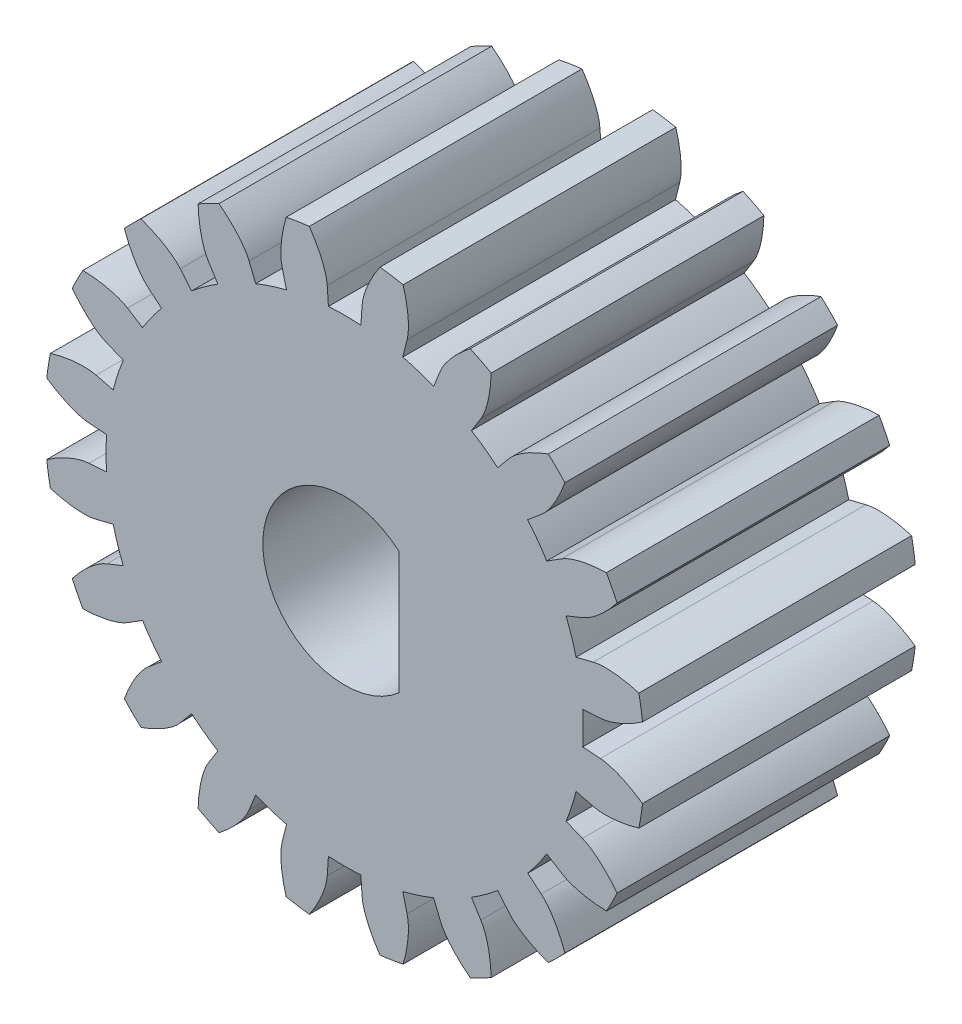
from build123d import *

# Parameters (mm, degrees)
SKETCH_1_R               = 5.5
SKETCH_1_R_2             = 1.475
EXTRUDE_1_DEPTH          = 5
CUT_EXTRUDE_1_DEPTH      = 10.246621004
PATTERN_CIRCULAR_1_DEPTH = 5
SKETCH_2_R               = 1.475
EXTRUDE_2_DEPTH          = 5
CUT_EXTRUDE_2_DEPTH      = 10.201182413


# Read off the part's stored shape, not the designer's step: 阵列(圆周)1
with BuildPart() as part:
    # 草图1 → 凸台-拉伸1 (new body)
    with BuildSketch(Plane.XY):
        Circle(SKETCH_1_R)
        Circle(SKETCH_1_R_2, mode=Mode.SUBTRACT)
    extrude(amount=EXTRUDE_1_DEPTH)

    # 草图1<3> → 切除-拉伸1 (cut, through all)
    with BuildSketch(Plane.XY):
        with BuildLine():
            Line((4.68759624, 0.319369739), (4.364881259, 0.297382905))
            ThreePointArc((4.364881259, 0.297382905), (4.372469583, 0.148777503), (4.375, 0))
            ThreePointArc((4.375, 0), (4.372469583, -0.148777503), (4.364881259, -0.297382905))
            Line((4.364881259, -0.297382905), (4.68759624, -0.319369739))
            add(Edge.make_bspline(
                [(4.68759624, -0.319369739), (4.723328518, -0.321804208), (4.822539562, -0.336024472), (5.006239619, -0.392562489), (5.199142564, -0.482491423), (5.35109765, -0.572850293), (5.444197274, -0.635344688), (5.461765036, -0.647396861)],
                knots=[0, 0, 0, 0, 0, 0.005604068, 0.015718248, 0.029959916, 0.033300536, 0.033300536, 0.033300536, 0.033300536, 0.033300536], degree=4))
            ThreePointArc((5.461765036, -0.647396861), (5.490432938, -0.324262474), (5.5, 0))
            ThreePointArc((5.5, 0), (5.490432938, 0.324262474), (5.461765036, 0.647396861))
            add(Edge.make_bspline(
                [(4.68759624, 0.319369739), (4.723328518, 0.321804208), (4.822539562, 0.336024472), (5.006239619, 0.392562489), (5.199142564, 0.482491423), (5.35109765, 0.572850293), (5.444197274, 0.635344688), (5.461765036, 0.647396861)],
                knots=[0, 0, 0, 0, 0, 0.005604068, 0.015718248, 0.029959916, 0.033300536, 0.033300536, 0.033300536, 0.033300536, 0.033300536], degree=4))
        make_face()
    extrude(amount=CUT_EXTRUDE_1_DEPTH, mode=Mode.SUBTRACT)

    # 阵列(圆周)1 outline → 阵列(圆周)1 (cut)
    with BuildSketch(Plane.XY):
        with BuildLine():
            Line((4.243145136, 1.065994538), (4.556859627, 1.14480823))
            add(Edge.make_bspline(
                [(4.556859627, 1.14480823), (4.591595335, 1.153534793), (4.690344948, 1.170668417), (4.882525293, 1.173664007), (5.093776464, 1.147746796), (5.266216765, 1.108767108), (5.374071599, 1.078100773), (5.39450386, 1.072067212)],
                knots=[0, 0, 0, 0, 0, 0.005604068, 0.015718248, 0.029959916, 0.033300536, 0.033300536, 0.033300536, 0.033300536, 0.033300536], degree=4))
            ThreePointArc((5.39450386, 1.072067212), (5.23081084, 1.699593469), (4.994390596, 2.303489219))
            add(Edge.make_bspline(
                [(4.359478273, 1.752285572), (4.392709397, 1.765642771), (4.482670403, 1.809824945), (4.639908332, 1.920362233), (4.795580365, 2.065500021), (4.912175813, 2.198393117), (4.981406987, 2.286598184), (4.994390596, 2.303489219)],
                knots=[0, 0, 0, 0, 0, 0.005604068, 0.015718248, 0.029959916, 0.033300536, 0.033300536, 0.033300536, 0.033300536, 0.033300536], degree=4))
            Line((4.359478273, 1.752285572), (4.059352393, 1.631650437))
            ThreePointArc((4.059352393, 1.631650437), (4.160872259, 1.35194935), (4.243145136, 1.065994538))
        make_face()
        with BuildLine():
            add(Edge.make_bspline(
                [(4.359478273, -1.752285572), (4.392709397, -1.765642771), (4.482670403, -1.809824945), (4.639908332, -1.920362233), (4.795580365, -2.065500021), (4.912175813, -2.198393117), (4.981406987, -2.286598184), (4.994390595, -2.303489218)],
                knots=[0, 0, 0, 0, 0, 0.005604068, 0.015718248, 0.029959916, 0.033300536, 0.033300536, 0.033300536, 0.033300536, 0.033300536], degree=4))
            ThreePointArc((4.994390595, -2.303489218), (5.23081084, -1.699593469), (5.39450386, -1.072067212))
            add(Edge.make_bspline(
                [(4.556859627, -1.14480823), (4.591595335, -1.153534793), (4.690344948, -1.170668417), (4.882525293, -1.173664007), (5.093776464, -1.147746796), (5.266216765, -1.108767108), (5.374071599, -1.078100773), (5.39450386, -1.072067212)],
                knots=[0, 0, 0, 0, 0, 0.005604068, 0.015718248, 0.029959916, 0.033300536, 0.033300536, 0.033300536, 0.033300536, 0.033300536], degree=4))
            Line((4.556859627, -1.14480823), (4.243145136, -1.065994538))
            ThreePointArc((4.243145136, -1.065994538), (4.160872259, -1.35194935), (4.059352393, -1.631650437))
            Line((4.059352393, -1.631650437), (4.359478273, -1.752285572))
        make_face()
        with BuildLine():
            add(Edge.make_bspline(
                [(3.604624198, -3.013675485), (3.632101274, -3.036647918), (3.704006232, -3.106467142), (3.819390489, -3.260183543), (3.922593347, -3.446323085), (3.992415983, -3.608741904), (4.031001877, -3.714023518), (4.038130406, -3.734100002)],
                knots=[0, 0, 0, 0, 0, 0.005604068, 0.015718248, 0.029959916, 0.033300536, 0.033300536, 0.033300536, 0.033300536, 0.033300536], degree=4))
            ThreePointArc((4.038130406, -3.734100002), (4.449593469, -3.232818888), (4.799191061, -2.686589877))
            add(Edge.make_bspline(
                [(3.980065843, -2.496924392), (4.010404809, -2.515957772), (4.099026691, -2.562768124), (4.280875372, -2.625004093), (4.489796033, -2.665635562), (4.665841891, -2.681850659), (4.777894353, -2.686014218), (4.799191061, -2.686589877)],
                knots=[0, 0, 0, 0, 0, 0.005604068, 0.015718248, 0.029959916, 0.033300536, 0.033300536, 0.033300536, 0.033300536, 0.033300536], degree=4))
            Line((3.980065843, -2.496924392), (3.706060403, -2.325025008))
            ThreePointArc((3.706060403, -2.325025008), (3.53944935, -2.571560479), (3.356465831, -2.806200656))
            Line((3.356465831, -2.806200656), (3.604624198, -3.013675485))
        make_face()
        with BuildLine():
            add(Edge.make_bspline(
                [(2.496924392, -3.980065843), (2.515957772, -4.010404809), (2.562768124, -4.099026691), (2.625004093, -4.280875372), (2.665635562, -4.489796033), (2.681850659, -4.665841891), (2.686014218, -4.777894353), (2.686589877, -4.79919106)],
                knots=[0, 0, 0, 0, 0, 0.005604068, 0.015718248, 0.029959916, 0.033300536, 0.033300536, 0.033300536, 0.033300536, 0.033300536], degree=4))
            ThreePointArc((2.686589877, -4.79919106), (3.232818888, -4.449593469), (3.734100002, -4.038130406))
            add(Edge.make_bspline(
                [(3.013675485, -3.604624198), (3.036647918, -3.632101274), (3.106467142, -3.704006232), (3.260183543, -3.819390489), (3.446323085, -3.922593347), (3.608741904, -3.992415983), (3.714023518, -4.031001877), (3.734100002, -4.038130406)],
                knots=[0, 0, 0, 0, 0, 0.005604068, 0.015718248, 0.029959916, 0.033300536, 0.033300536, 0.033300536, 0.033300536, 0.033300536], degree=4))
            Line((3.013675485, -3.604624198), (2.806200656, -3.356465831))
            ThreePointArc((2.806200656, -3.356465831), (2.571560479, -3.53944935), (2.325025008, -3.706060403))
            Line((2.325025008, -3.706060403), (2.496924392, -3.980065843))
        make_face()
        with BuildLine():
            add(Edge.make_bspline(
                [(1.14480823, -4.556859627), (1.153534793, -4.591595335), (1.170668417, -4.690344948), (1.173664007, -4.882525293), (1.147746796, -5.093776464), (1.108767108, -5.266216765), (1.078100773, -5.374071599), (1.072067212, -5.39450386)],
                knots=[0, 0, 0, 0, 0, 0.005604068, 0.015718248, 0.029959916, 0.033300536, 0.033300536, 0.033300536, 0.033300536, 0.033300536], degree=4))
            ThreePointArc((1.072067212, -5.39450386), (1.699593469, -5.23081084), (2.303489219, -4.994390596))
            add(Edge.make_bspline(
                [(1.752285572, -4.359478273), (1.765642771, -4.392709397), (1.809824945, -4.482670403), (1.920362233, -4.639908332), (2.065500021, -4.795580365), (2.198393117, -4.912175813), (2.286598184, -4.981406987), (2.303489219, -4.994390596)],
                knots=[0, 0, 0, 0, 0, 0.005604068, 0.015718248, 0.029959916, 0.033300536, 0.033300536, 0.033300536, 0.033300536, 0.033300536], degree=4))
            Line((1.752285572, -4.359478273), (1.631650437, -4.059352393))
            ThreePointArc((1.631650437, -4.059352393), (1.35194935, -4.160872259), (1.065994538, -4.243145136))
            Line((1.065994538, -4.243145136), (1.14480823, -4.556859627))
        make_face()
        with BuildLine():
            add(Edge.make_bspline(
                [(-0.319369739, -4.68759624), (-0.321804208, -4.723328518), (-0.336024472, -4.822539562), (-0.392562489, -5.006239619), (-0.482491423, -5.199142564), (-0.572850293, -5.35109765), (-0.635344688, -5.444197274), (-0.647396861, -5.461765036)],
                knots=[0, 0, 0, 0, 0, 0.005604068, 0.015718248, 0.029959916, 0.033300536, 0.033300536, 0.033300536, 0.033300536, 0.033300536], degree=4))
            ThreePointArc((-0.647396861, -5.461765036), (0, -5.5), (0.647396861, -5.461765036))
            add(Edge.make_bspline(
                [(0.319369739, -4.68759624), (0.321804208, -4.723328518), (0.336024472, -4.822539562), (0.392562489, -5.006239619), (0.482491423, -5.199142564), (0.572850293, -5.35109765), (0.635344688, -5.444197274), (0.647396861, -5.461765036)],
                knots=[0, 0, 0, 0, 0, 0.005604068, 0.015718248, 0.029959916, 0.033300536, 0.033300536, 0.033300536, 0.033300536, 0.033300536], degree=4))
            Line((0.319369739, -4.68759624), (0.297382905, -4.364881259))
            ThreePointArc((0.297382905, -4.364881259), (0, -4.375), (-0.297382905, -4.364881259))
            Line((-0.297382905, -4.364881259), (-0.319369739, -4.68759624))
        make_face()
        with BuildLine():
            add(Edge.make_bspline(
                [(-1.752285572, -4.359478273), (-1.765642771, -4.392709397), (-1.809824945, -4.482670403), (-1.920362233, -4.639908332), (-2.065500021, -4.795580365), (-2.198393117, -4.912175813), (-2.286598184, -4.981406987), (-2.303489218, -4.994390595)],
                knots=[0, 0, 0, 0, 0, 0.005604068, 0.015718248, 0.029959916, 0.033300536, 0.033300536, 0.033300536, 0.033300536, 0.033300536], degree=4))
            ThreePointArc((-2.303489218, -4.994390595), (-1.699593469, -5.23081084), (-1.072067212, -5.39450386))
            add(Edge.make_bspline(
                [(-1.14480823, -4.556859627), (-1.153534793, -4.591595335), (-1.170668417, -4.690344948), (-1.173664007, -4.882525293), (-1.147746796, -5.093776464), (-1.108767108, -5.266216765), (-1.078100773, -5.374071599), (-1.072067212, -5.39450386)],
                knots=[0, 0, 0, 0, 0, 0.005604068, 0.015718248, 0.029959916, 0.033300536, 0.033300536, 0.033300536, 0.033300536, 0.033300536], degree=4))
            Line((-1.14480823, -4.556859627), (-1.065994538, -4.243145136))
            ThreePointArc((-1.065994538, -4.243145136), (-1.35194935, -4.160872259), (-1.631650437, -4.059352393))
            Line((-1.631650437, -4.059352393), (-1.752285572, -4.359478273))
        make_face()
        with BuildLine():
            add(Edge.make_bspline(
                [(-3.013675485, -3.604624198), (-3.036647918, -3.632101274), (-3.106467142, -3.704006232), (-3.260183543, -3.819390489), (-3.446323085, -3.922593347), (-3.608741904, -3.992415983), (-3.714023518, -4.031001877), (-3.734100002, -4.038130406)],
                knots=[0, 0, 0, 0, 0, 0.005604068, 0.015718248, 0.029959916, 0.033300536, 0.033300536, 0.033300536, 0.033300536, 0.033300536], degree=4))
            ThreePointArc((-3.734100002, -4.038130406), (-3.232818888, -4.449593469), (-2.686589877, -4.79919106))
            add(Edge.make_bspline(
                [(-2.496924392, -3.980065843), (-2.515957772, -4.010404809), (-2.562768124, -4.099026691), (-2.625004093, -4.280875372), (-2.665635562, -4.489796033), (-2.681850659, -4.665841891), (-2.686014218, -4.777894353), (-2.686589877, -4.79919106)],
                knots=[0, 0, 0, 0, 0, 0.005604068, 0.015718248, 0.029959916, 0.033300536, 0.033300536, 0.033300536, 0.033300536, 0.033300536], degree=4))
            Line((-2.496924392, -3.980065843), (-2.325025008, -3.706060403))
            ThreePointArc((-2.325025008, -3.706060403), (-2.571560479, -3.53944935), (-2.806200656, -3.356465831))
            Line((-2.806200656, -3.356465831), (-3.013675485, -3.604624198))
        make_face()
        with BuildLine():
            add(Edge.make_bspline(
                [(-3.980065843, -2.496924392), (-4.010404809, -2.515957772), (-4.099026691, -2.562768124), (-4.280875372, -2.625004093), (-4.489796033, -2.665635562), (-4.665841891, -2.681850659), (-4.777894353, -2.686014218), (-4.79919106, -2.686589877)],
                knots=[0, 0, 0, 0, 0, 0.005604068, 0.015718248, 0.029959916, 0.033300536, 0.033300536, 0.033300536, 0.033300536, 0.033300536], degree=4))
            ThreePointArc((-4.79919106, -2.686589877), (-4.449593469, -3.232818888), (-4.038130406, -3.734100002))
            add(Edge.make_bspline(
                [(-3.604624198, -3.013675485), (-3.632101274, -3.036647918), (-3.704006232, -3.106467142), (-3.819390489, -3.260183543), (-3.922593347, -3.446323085), (-3.992415983, -3.608741904), (-4.031001877, -3.714023518), (-4.038130406, -3.734100002)],
                knots=[0, 0, 0, 0, 0, 0.005604068, 0.015718248, 0.029959916, 0.033300536, 0.033300536, 0.033300536, 0.033300536, 0.033300536], degree=4))
            Line((-3.604624198, -3.013675485), (-3.356465831, -2.806200656))
            ThreePointArc((-3.356465831, -2.806200656), (-3.53944935, -2.571560479), (-3.706060403, -2.325025008))
            Line((-3.706060403, -2.325025008), (-3.980065843, -2.496924392))
        make_face()
        with BuildLine():
            add(Edge.make_bspline(
                [(-4.556859627, -1.14480823), (-4.591595335, -1.153534793), (-4.690344948, -1.170668417), (-4.882525293, -1.173664007), (-5.093776464, -1.147746796), (-5.266216765, -1.108767108), (-5.374071599, -1.078100773), (-5.39450386, -1.072067212)],
                knots=[0, 0, 0, 0, 0, 0.005604068, 0.015718248, 0.029959916, 0.033300536, 0.033300536, 0.033300536, 0.033300536, 0.033300536], degree=4))
            ThreePointArc((-5.39450386, -1.072067212), (-5.23081084, -1.699593469), (-4.994390596, -2.303489218))
            add(Edge.make_bspline(
                [(-4.359478273, -1.752285572), (-4.392709397, -1.765642771), (-4.482670403, -1.809824945), (-4.639908332, -1.920362233), (-4.795580365, -2.065500021), (-4.912175813, -2.198393117), (-4.981406987, -2.286598184), (-4.994390596, -2.303489218)],
                knots=[0, 0, 0, 0, 0, 0.005604068, 0.015718248, 0.029959916, 0.033300536, 0.033300536, 0.033300536, 0.033300536, 0.033300536], degree=4))
            Line((-4.359478273, -1.752285572), (-4.059352393, -1.631650437))
            ThreePointArc((-4.059352393, -1.631650437), (-4.160872259, -1.35194935), (-4.243145136, -1.065994538))
            Line((-4.243145136, -1.065994538), (-4.556859627, -1.14480823))
        make_face()
        with BuildLine():
            add(Edge.make_bspline(
                [(-4.68759624, 0.319369739), (-4.723328518, 0.321804208), (-4.822539562, 0.336024472), (-5.006239619, 0.392562489), (-5.199142564, 0.482491423), (-5.35109765, 0.572850293), (-5.444197274, 0.635344688), (-5.461765036, 0.647396861)],
                knots=[0, 0, 0, 0, 0, 0.005604068, 0.015718248, 0.029959916, 0.033300536, 0.033300536, 0.033300536, 0.033300536, 0.033300536], degree=4))
            ThreePointArc((-5.461765036, 0.647396861), (-5.5, 0), (-5.461765036, -0.647396861))
            add(Edge.make_bspline(
                [(-4.68759624, -0.319369739), (-4.723328518, -0.321804208), (-4.822539562, -0.336024472), (-5.006239619, -0.392562489), (-5.199142564, -0.482491423), (-5.35109765, -0.572850293), (-5.444197274, -0.635344688), (-5.461765036, -0.647396861)],
                knots=[0, 0, 0, 0, 0, 0.005604068, 0.015718248, 0.029959916, 0.033300536, 0.033300536, 0.033300536, 0.033300536, 0.033300536], degree=4))
            Line((-4.68759624, -0.319369739), (-4.364881259, -0.297382905))
            ThreePointArc((-4.364881259, -0.297382905), (-4.375, 0), (-4.364881259, 0.297382905))
            Line((-4.364881259, 0.297382905), (-4.68759624, 0.319369739))
        make_face()
        with BuildLine():
            add(Edge.make_bspline(
                [(-4.359478273, 1.752285572), (-4.392709397, 1.765642771), (-4.482670403, 1.809824945), (-4.639908332, 1.920362233), (-4.795580365, 2.065500021), (-4.912175813, 2.198393117), (-4.981406987, 2.286598184), (-4.994390595, 2.303489218)],
                knots=[0, 0, 0, 0, 0, 0.005604068, 0.015718248, 0.029959916, 0.033300536, 0.033300536, 0.033300536, 0.033300536, 0.033300536], degree=4))
            ThreePointArc((-4.994390595, 2.303489218), (-5.23081084, 1.699593469), (-5.39450386, 1.072067212))
            add(Edge.make_bspline(
                [(-4.556859627, 1.14480823), (-4.591595335, 1.153534793), (-4.690344948, 1.170668417), (-4.882525293, 1.173664007), (-5.093776464, 1.147746796), (-5.266216765, 1.108767108), (-5.374071599, 1.078100773), (-5.39450386, 1.072067212)],
                knots=[0, 0, 0, 0, 0, 0.005604068, 0.015718248, 0.029959916, 0.033300536, 0.033300536, 0.033300536, 0.033300536, 0.033300536], degree=4))
            Line((-4.556859627, 1.14480823), (-4.243145136, 1.065994538))
            ThreePointArc((-4.243145136, 1.065994538), (-4.160872259, 1.35194935), (-4.059352393, 1.631650437))
            Line((-4.059352393, 1.631650437), (-4.359478273, 1.752285572))
        make_face()
        with BuildLine():
            add(Edge.make_bspline(
                [(-3.604624198, 3.013675485), (-3.632101274, 3.036647918), (-3.704006232, 3.106467142), (-3.819390489, 3.260183543), (-3.922593347, 3.446323085), (-3.992415983, 3.608741904), (-4.031001877, 3.714023518), (-4.038130406, 3.734100002)],
                knots=[0, 0, 0, 0, 0, 0.005604068, 0.015718248, 0.029959916, 0.033300536, 0.033300536, 0.033300536, 0.033300536, 0.033300536], degree=4))
            ThreePointArc((-4.038130406, 3.734100002), (-4.449593469, 3.232818888), (-4.79919106, 2.686589877))
            add(Edge.make_bspline(
                [(-3.980065843, 2.496924392), (-4.010404809, 2.515957772), (-4.099026691, 2.562768124), (-4.280875372, 2.625004093), (-4.489796033, 2.665635562), (-4.665841891, 2.681850659), (-4.777894353, 2.686014218), (-4.79919106, 2.686589877)],
                knots=[0, 0, 0, 0, 0, 0.005604068, 0.015718248, 0.029959916, 0.033300536, 0.033300536, 0.033300536, 0.033300536, 0.033300536], degree=4))
            Line((-3.980065843, 2.496924392), (-3.706060403, 2.325025008))
            ThreePointArc((-3.706060403, 2.325025008), (-3.53944935, 2.571560479), (-3.356465831, 2.806200656))
            Line((-3.356465831, 2.806200656), (-3.604624198, 3.013675485))
        make_face()
        with BuildLine():
            add(Edge.make_bspline(
                [(-2.496924392, 3.980065843), (-2.515957772, 4.010404809), (-2.562768124, 4.099026691), (-2.625004093, 4.280875372), (-2.665635562, 4.489796033), (-2.681850659, 4.665841891), (-2.686014218, 4.777894353), (-2.686589877, 4.79919106)],
                knots=[0, 0, 0, 0, 0, 0.005604068, 0.015718248, 0.029959916, 0.033300536, 0.033300536, 0.033300536, 0.033300536, 0.033300536], degree=4))
            ThreePointArc((-2.686589877, 4.79919106), (-3.232818888, 4.449593469), (-3.734100002, 4.038130406))
            add(Edge.make_bspline(
                [(-3.013675485, 3.604624198), (-3.036647918, 3.632101274), (-3.106467142, 3.704006232), (-3.260183543, 3.819390489), (-3.446323085, 3.922593347), (-3.608741904, 3.992415983), (-3.714023518, 4.031001877), (-3.734100002, 4.038130406)],
                knots=[0, 0, 0, 0, 0, 0.005604068, 0.015718248, 0.029959916, 0.033300536, 0.033300536, 0.033300536, 0.033300536, 0.033300536], degree=4))
            Line((-3.013675485, 3.604624198), (-2.806200656, 3.356465831))
            ThreePointArc((-2.806200656, 3.356465831), (-2.571560479, 3.53944935), (-2.325025008, 3.706060403))
            Line((-2.325025008, 3.706060403), (-2.496924392, 3.980065843))
        make_face()
        with BuildLine():
            add(Edge.make_bspline(
                [(-1.14480823, 4.556859627), (-1.153534793, 4.591595335), (-1.170668417, 4.690344948), (-1.173664007, 4.882525293), (-1.147746796, 5.093776464), (-1.108767108, 5.266216765), (-1.078100773, 5.374071599), (-1.072067212, 5.39450386)],
                knots=[0, 0, 0, 0, 0, 0.005604068, 0.015718248, 0.029959916, 0.033300536, 0.033300536, 0.033300536, 0.033300536, 0.033300536], degree=4))
            ThreePointArc((-1.072067212, 5.39450386), (-1.699593469, 5.23081084), (-2.303489219, 4.994390596))
            add(Edge.make_bspline(
                [(-1.752285572, 4.359478273), (-1.765642771, 4.392709397), (-1.809824945, 4.482670403), (-1.920362233, 4.639908332), (-2.065500021, 4.795580365), (-2.198393117, 4.912175813), (-2.286598184, 4.981406987), (-2.303489219, 4.994390596)],
                knots=[0, 0, 0, 0, 0, 0.005604068, 0.015718248, 0.029959916, 0.033300536, 0.033300536, 0.033300536, 0.033300536, 0.033300536], degree=4))
            Line((-1.752285572, 4.359478273), (-1.631650437, 4.059352393))
            ThreePointArc((-1.631650437, 4.059352393), (-1.35194935, 4.160872259), (-1.065994538, 4.243145136))
            Line((-1.065994538, 4.243145136), (-1.14480823, 4.556859627))
        make_face()
        with BuildLine():
            add(Edge.make_bspline(
                [(0.319369739, 4.68759624), (0.321804208, 4.723328518), (0.336024472, 4.822539562), (0.392562489, 5.006239619), (0.482491423, 5.199142564), (0.572850293, 5.35109765), (0.635344688, 5.444197274), (0.647396861, 5.461765036)],
                knots=[0, 0, 0, 0, 0, 0.005604068, 0.015718248, 0.029959916, 0.033300536, 0.033300536, 0.033300536, 0.033300536, 0.033300536], degree=4))
            ThreePointArc((0.647396861, 5.461765036), (0, 5.5), (-0.647396861, 5.461765036))
            add(Edge.make_bspline(
                [(-0.319369739, 4.68759624), (-0.321804208, 4.723328518), (-0.336024472, 4.822539562), (-0.392562489, 5.006239619), (-0.482491423, 5.199142564), (-0.572850293, 5.35109765), (-0.635344688, 5.444197274), (-0.647396861, 5.461765036)],
                knots=[0, 0, 0, 0, 0, 0.005604068, 0.015718248, 0.029959916, 0.033300536, 0.033300536, 0.033300536, 0.033300536, 0.033300536], degree=4))
            Line((-0.319369739, 4.68759624), (-0.297382905, 4.364881259))
            ThreePointArc((-0.297382905, 4.364881259), (0, 4.375), (0.297382905, 4.364881259))
            Line((0.297382905, 4.364881259), (0.319369739, 4.68759624))
        make_face()
        with BuildLine():
            add(Edge.make_bspline(
                [(1.752285572, 4.359478273), (1.765642771, 4.392709397), (1.809824945, 4.482670403), (1.920362233, 4.639908332), (2.065500021, 4.795580365), (2.198393117, 4.912175813), (2.286598184, 4.981406987), (2.303489218, 4.994390595)],
                knots=[0, 0, 0, 0, 0, 0.005604068, 0.015718248, 0.029959916, 0.033300536, 0.033300536, 0.033300536, 0.033300536, 0.033300536], degree=4))
            ThreePointArc((2.303489218, 4.994390595), (1.699593469, 5.23081084), (1.072067212, 5.39450386))
            add(Edge.make_bspline(
                [(1.14480823, 4.556859627), (1.153534793, 4.591595335), (1.170668417, 4.690344948), (1.173664007, 4.882525293), (1.147746796, 5.093776464), (1.108767108, 5.266216765), (1.078100773, 5.374071599), (1.072067212, 5.39450386)],
                knots=[0, 0, 0, 0, 0, 0.005604068, 0.015718248, 0.029959916, 0.033300536, 0.033300536, 0.033300536, 0.033300536, 0.033300536], degree=4))
            Line((1.14480823, 4.556859627), (1.065994538, 4.243145136))
            ThreePointArc((1.065994538, 4.243145136), (1.35194935, 4.160872259), (1.631650437, 4.059352393))
            Line((1.631650437, 4.059352393), (1.752285572, 4.359478273))
        make_face()
        with BuildLine():
            add(Edge.make_bspline(
                [(3.013675485, 3.604624198), (3.036647918, 3.632101274), (3.106467142, 3.704006232), (3.260183543, 3.819390489), (3.446323085, 3.922593347), (3.608741904, 3.992415983), (3.714023518, 4.031001877), (3.734100002, 4.038130406)],
                knots=[0, 0, 0, 0, 0, 0.005604068, 0.015718248, 0.029959916, 0.033300536, 0.033300536, 0.033300536, 0.033300536, 0.033300536], degree=4))
            ThreePointArc((3.734100002, 4.038130406), (3.232818888, 4.449593469), (2.686589877, 4.799191061))
            add(Edge.make_bspline(
                [(2.496924392, 3.980065843), (2.515957772, 4.010404809), (2.562768124, 4.099026691), (2.625004093, 4.280875372), (2.665635562, 4.489796033), (2.681850659, 4.665841891), (2.686014218, 4.777894353), (2.686589877, 4.799191061)],
                knots=[0, 0, 0, 0, 0, 0.005604068, 0.015718248, 0.029959916, 0.033300536, 0.033300536, 0.033300536, 0.033300536, 0.033300536], degree=4))
            Line((2.496924392, 3.980065843), (2.325025008, 3.706060403))
            ThreePointArc((2.325025008, 3.706060403), (2.571560479, 3.53944935), (2.806200656, 3.356465831))
            Line((2.806200656, 3.356465831), (3.013675485, 3.604624198))
        make_face()
        with BuildLine():
            add(Edge.make_bspline(
                [(3.980065843, 2.496924392), (4.010404809, 2.515957772), (4.099026691, 2.562768124), (4.280875372, 2.625004093), (4.489796033, 2.665635562), (4.665841891, 2.681850659), (4.777894353, 2.686014218), (4.79919106, 2.686589877)],
                knots=[0, 0, 0, 0, 0, 0.005604068, 0.015718248, 0.029959916, 0.033300536, 0.033300536, 0.033300536, 0.033300536, 0.033300536], degree=4))
            ThreePointArc((4.79919106, 2.686589877), (4.449593469, 3.232818888), (4.038130406, 3.734100002))
            add(Edge.make_bspline(
                [(3.604624198, 3.013675485), (3.632101274, 3.036647918), (3.704006232, 3.106467142), (3.819390489, 3.260183543), (3.922593347, 3.446323085), (3.992415983, 3.608741904), (4.031001877, 3.714023518), (4.038130406, 3.734100002)],
                knots=[0, 0, 0, 0, 0, 0.005604068, 0.015718248, 0.029959916, 0.033300536, 0.033300536, 0.033300536, 0.033300536, 0.033300536], degree=4))
            Line((3.604624198, 3.013675485), (3.356465831, 2.806200656))
            ThreePointArc((3.356465831, 2.806200656), (3.53944935, 2.571560479), (3.706060403, 2.325025008))
            Line((3.706060403, 2.325025008), (3.980065843, 2.496924392))
        make_face()
    extrude(amount=PATTERN_CIRCULAR_1_DEPTH, mode=Mode.SUBTRACT)

    # 草图2 → 凸台-拉伸2 (add, through all)
    with BuildSketch(Plane.XY.offset(5)):
        Circle(SKETCH_2_R)
    extrude(amount=-EXTRUDE_2_DEPTH)

    # 草图3 → 切除-拉伸2 (cut, through all)
    with BuildSketch(Plane.XY.offset(5)):
        with BuildLine():
            Line((1, -1.118033989), (1, 1.118033989))
            ThreePointArc((1, 1.118033989), (-1.5, 0), (1, -1.118033989))
        make_face()
    extrude(amount=-CUT_EXTRUDE_2_DEPTH, mode=Mode.SUBTRACT)


solid = part.part
